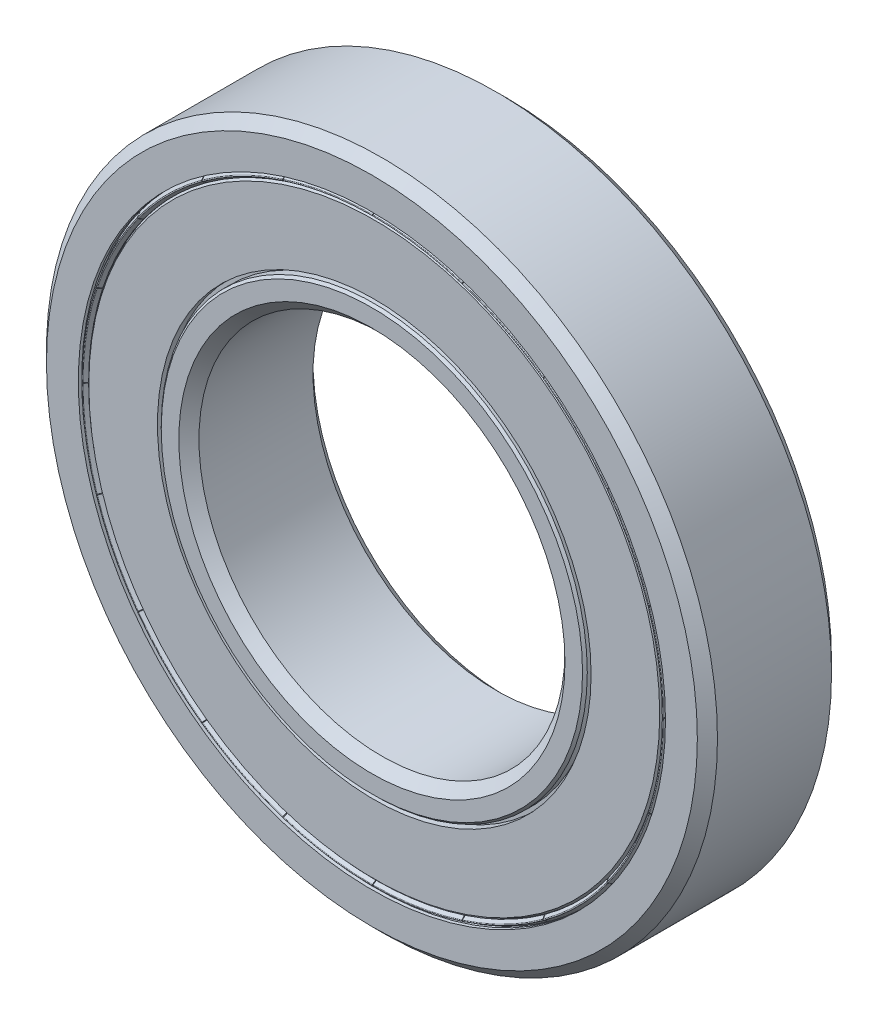
from build123d import *
from build123d.topology import SkipClean

# Parameters (mm, degrees)
CIRPATTERN1_COUNT  = 10
FILLET1_R          = 0.11
CUT_EXTRUDE1_START = 10.019596
CUT_EXTRUDE1_DEPTH = 69.536116714
CIRPATTERN2_COUNT  = 20


with BuildPart() as part:
    # Sketch3 → Revolve1 (revolve)
    with BuildSketch(Plane(origin=(0, 0, 0), x_dir=(0, 0, -1), z_dir=(1, 0, 0)), mode=Mode.PRIVATE) as revolve1_sk:
        with BuildLine():
            Line((9.35, 55), (-9.35, 55))
            Line((-9.35, 55), (-11, 53.35))
            Line((-11, 53.35), (-11, 48.127627107))
            Line((-11, 48.127627107), (-10.45, 48.127627107))
            Line((-10.45, 48.127627107), (-10.45, 49.688813553))
            Line((-10.45, 49.688813553), (-10.06109127, 50.077722283))
            Line((-10.06109127, 50.077722283), (-4.375, 50.077722283))
            ThreePointArc((-4.375, 50.077722283), (0, 51.25), (4.375, 50.077722283))
            Line((4.375, 50.077722283), (10.06109127, 50.077722283))
            Line((10.06109127, 50.077722283), (10.45, 49.688813553))
            Line((10.45, 49.688813553), (10.45, 48.127627107))
            Line((10.45, 48.127627107), (11, 48.127627107))
            Line((11, 48.127627107), (11, 53.35))
            Line((11, 53.35), (9.35, 55))
        make_face()
        with BuildLine():
            Line((9.35, 30), (-9.35, 30))
            Line((-9.35, 30), (-11, 31.65))
            Line((-11, 31.65), (-11, 34.533368987))
            Line((-11, 34.533368987), (-10.61109127, 34.922277717))
            Line((-10.61109127, 34.922277717), (-4.375, 34.922277717))
            ThreePointArc((-4.375, 34.922277717), (0, 33.75), (4.375, 34.922277717))
            Line((4.375, 34.922277717), (10.61109127, 34.922277717))
            Line((10.61109127, 34.922277717), (11, 34.533368987))
            Line((11, 34.533368987), (11, 31.65))
            Line((11, 31.65), (9.35, 30))
        make_face()
    revolve(revolve1_sk.sketch.rotate(Axis((0, 0, 11), (0, 0, -1)), 90), axis=Axis((0, 0, 11), (0, 0, -1)))


with BuildPart() as body_2:
    # Sketch4 → Revolve2 (revolve)
    with BuildSketch(Plane(origin=(0, 0, 0), x_dir=(0, 0, -1), z_dir=(1, 0, 0))):
        with BuildLine():
            Line((0, 51.25), (0, 33.75))
            ThreePointArc((0, 33.75), (-8.75, 42.5), (0, 51.25))
        make_face()
    revolve(axis=Axis((0, 55, 0), (0, -1, 0)))


with BuildPart() as cirpattern1_1:
    # CirPattern1: pattern copy
    add(body_2.part.rotate(Axis((0, 0, 0), (0, 0, 1)), 1 * 360 / CIRPATTERN1_COUNT))


with BuildPart() as cirpattern1_2:
    # CirPattern1: pattern copy
    add(body_2.part.rotate(Axis((0, 0, 0), (0, 0, 1)), 2 * 360 / CIRPATTERN1_COUNT))


with BuildPart() as cirpattern1_3:
    # CirPattern1: pattern copy
    add(body_2.part.rotate(Axis((0, 0, 0), (0, 0, 1)), 3 * 360 / CIRPATTERN1_COUNT))


with BuildPart() as cirpattern1_4:
    # CirPattern1: pattern copy
    add(body_2.part.rotate(Axis((0, 0, 0), (0, 0, 1)), 4 * 360 / CIRPATTERN1_COUNT))


with BuildPart() as cirpattern1_5:
    # CirPattern1: pattern copy
    add(body_2.part.rotate(Axis((0, 0, 0), (0, 0, 1)), 5 * 360 / CIRPATTERN1_COUNT))


with BuildPart() as cirpattern1_6:
    # CirPattern1: pattern copy
    add(body_2.part.rotate(Axis((0, 0, 0), (0, 0, 1)), 6 * 360 / CIRPATTERN1_COUNT))


with BuildPart() as cirpattern1_7:
    # CirPattern1: pattern copy
    add(body_2.part.rotate(Axis((0, 0, 0), (0, 0, 1)), 7 * 360 / CIRPATTERN1_COUNT))


with BuildPart() as cirpattern1_8:
    # CirPattern1: pattern copy
    add(body_2.part.rotate(Axis((0, 0, 0), (0, 0, 1)), 8 * 360 / CIRPATTERN1_COUNT))


with BuildPart() as cirpattern1_9:
    # CirPattern1: pattern copy
    add(body_2.part.rotate(Axis((0, 0, 0), (0, 0, 1)), 9 * 360 / CIRPATTERN1_COUNT))


with BuildPart() as body_12:
    # Sketch5 → Revolve3 (revolve)
    with BuildSketch(Plane(origin=(0, 0, 0), x_dir=(0, 0, -1), z_dir=(1, 0, 0)), mode=Mode.PRIVATE) as revolve3_sk:
        Polygon((-8.75, 34.922277717), (-9.370363757, 34.922277717), (-9.370363757, 35.542641474), (-10.61109127, 35.542641474), (-10.61109127, 46.790928986), (-9.370363757, 47.50726335), (-8.75, 47.50726335), align=None)
        Polygon((9.370363757, 47.50726335), (8.75, 47.50726335), (8.75, 34.922277717), (9.370363757, 34.922277717), (9.370363757, 35.542641474), (10.61109127, 35.542641474), (10.61109127, 46.790928986), align=None)
    revolve(revolve3_sk.sketch.rotate(Axis((0, 0, 11), (0, 0, -1)), 90), axis=Axis((0, 0, 11), (0, 0, -1)))


with BuildPart() as body_13:
    # Sketch6 → Revolve4 (revolve)
    with BuildSketch(Plane(origin=(0, 0, 0), x_dir=(0, 0, -1), z_dir=(1, 0, 0)), mode=Mode.PRIVATE) as revolve4_sk:
        Polygon((-10.001692556, 48.127627107), (-10.0375, 48.127627107), (-11, 47.571927473), (-10.331692556, 47.103973562), (-10.221692556, 47.103973562), (-10.001692556, 47.142765498), align=None)
    revolve(revolve4_sk.sketch.rotate(Axis((0, 0, 11), (0, 0, -1)), 90), axis=Axis((0, 0, 11), (0, 0, -1)))

    # Fillet1
    fillet1_edges = [body_13.edges().sort_by_distance(p)[0] for p in [
        (-47.571927473, 0, 11),
    ]]
    fillet(fillet1_edges, radius=FILLET1_R)

    # Sketch7 → Cut-Extrude1 (cut, through all)
    with BuildSketch(Plane.XY.offset(CUT_EXTRUDE1_START)):
        Polygon((-0.05, 48.127627107), (-0.05, 48.227627107), (0.05, 48.227627107), (0.05, 48.127627107), (0.05, 47.103973562), (0.05, 47.003973562), (-0.05, 47.003973562), (-0.05, 47.103973562), align=None)
    cut_extrude1 = extrude(amount=CUT_EXTRUDE1_DEPTH, mode=Mode.SUBTRACT)

    # CirPattern2: Cut-Extrude1 ×20 about axis
    with SkipClean():  # the faces are left unmerged after this step: merging them gives an invalid solid
        cirpattern2_axis = Axis((0, 0, 0), (0, 0, 1))
        for i in range(1, CIRPATTERN2_COUNT):
            add(cut_extrude1.rotate(cirpattern2_axis, i * 360 / CIRPATTERN2_COUNT), mode=Mode.SUBTRACT)
    add(body_13.part.scale(1), mode=Mode.REPLACE)  # the faces are merged on a copy


with BuildPart() as body_14:
    # Mirror1: mirrored copy
    add(body_13.part.mirror(Plane.XY))


solid = Compound([part.part, body_2.part, cirpattern1_1.part, cirpattern1_2.part, cirpattern1_3.part, cirpattern1_4.part, cirpattern1_5.part, cirpattern1_6.part, cirpattern1_7.part, cirpattern1_8.part, cirpattern1_9.part, body_12.part, body_13.part, body_14.part])
